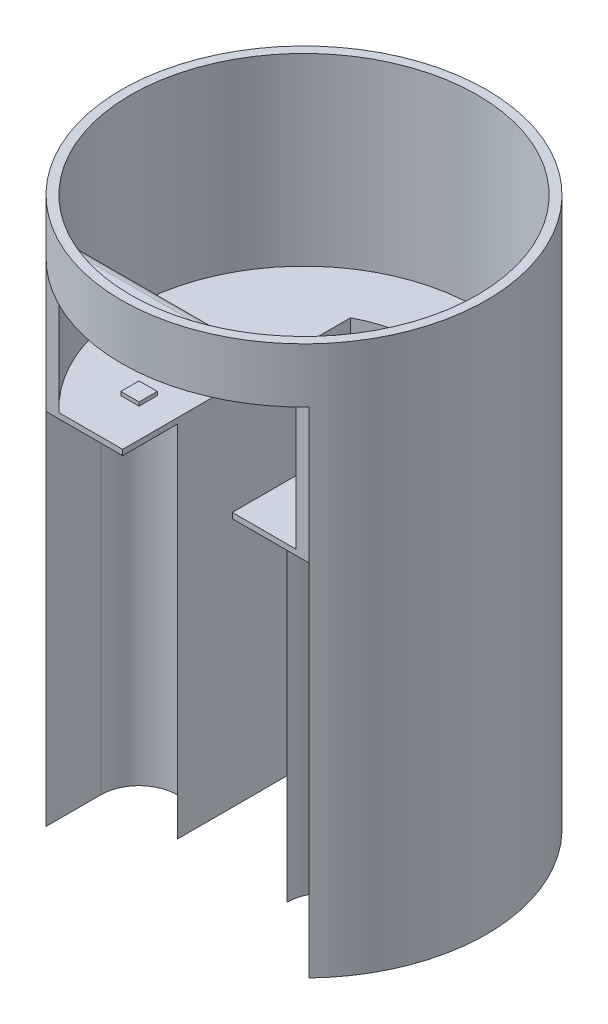
from build123d import *
from build123d.topology import SkipClean

# Parameters (mm, degrees)
BOSS_EXTRUDE2_DEPTH   = 200
BOSS_EXTRUDE2_2_DEPTH = 200
BOSS_EXTRUDE3_START   = -3
SKETCH3_W             = 10
SKETCH3_H             = 10
BOSS_EXTRUDE3_DEPTH   = 3
SKETCH4_W             = 10
SKETCH4_H             = 10
BOSS_EXTRUDE4_DEPTH   = 3
SKETCH5_W             = 10
SKETCH5_H             = 10
BOSS_EXTRUDE5_DEPTH   = 2
BOSS_EXTRUDE5_2_DEPTH = 2
BOSS_EXTRUDE6_START   = -200
BOSS_EXTRUDE6_DEPTH   = 200
BOSS_EXTRUDE7_DEPTH   = 101
BOSS_EXTRUDE8_START   = -15
BOSS_EXTRUDE8_DEPTH   = 15
BOSS_EXTRUDE9_START   = 15
BOSS_EXTRUDE9_DEPTH   = 15
FILLET2_R             = 6


with BuildPart() as part:
    # Sketch2 → Boss-Extrude2 (new body)
    with BuildSketch(Plane(origin=(0, 0, 0), x_dir=(1, 0, 0), z_dir=(0, 1, 0))):
        with BuildLine():
            Line((-29.936750537, 95.41378814), (-29.936750537, -39.462967992))
            ThreePointArc((-29.936750537, -39.462967992), (-50.936750537, -18.462967992), (-71.936750537, -39.462967992))
            Line((-71.936750537, -39.462967992), (-71.936750537, -69.462967992))
            ThreePointArc((-71.936750537, -69.462967992), (-96.905308077, 24.685243904), (-29.936750537, 95.41378814))
        make_face()
    extrude(amount=BOSS_EXTRUDE2_DEPTH)

    # Sketch3 → Boss-Extrude3 (add)
    with BuildSketch(Plane(origin=(0, 200, 0), x_dir=(1, 0, 0), z_dir=(0, 1, 0)).offset(BOSS_EXTRUDE3_START)):
        with BuildLine():
            Line((-71.936750537, -69.462967992), (-29.936750537, -69.462967992))
            Line((-29.936750537, -69.462967992), (-29.936750537, -39.462967992))
            ThreePointArc((-29.936750537, -39.462967992), (-50.936750537, -18.462967992), (-71.936750537, -39.462967992))
            Line((-71.936750537, -39.462967992), (-71.936750537, -69.462967992))
        make_face()
        with Locations((-50.936750537, -39.462967992)):
            Rectangle(SKETCH3_W, SKETCH3_H, mode=Mode.SUBTRACT)
    extrude(amount=BOSS_EXTRUDE3_DEPTH)



with BuildPart() as body_2:
    # Sketch2 → Boss-Extrude2 2 (new body)
    with BuildSketch(Plane(origin=(0, 0, 0), x_dir=(1, 0, 0), z_dir=(0, 1, 0))):
        with BuildLine():
            ThreePointArc((72.063249463, -69.331724894), (96.899173876, 24.709312052), (30.063249463, 95.374006059))
            Line((30.063249463, 95.374006059), (30.063249463, -39.462967992))
            ThreePointArc((30.063249463, -39.462967992), (51.063249463, -18.462967992), (72.063249463, -39.462967992))
            Line((72.063249463, -39.462967992), (72.063249463, -69.331724894))
        make_face()
    extrude(amount=BOSS_EXTRUDE2_2_DEPTH)

    # Sketch4 → Boss-Extrude4 (add)
    with BuildSketch(Plane(origin=(0, 200, 0), x_dir=(1, 0, 0), z_dir=(0, 1, 0))):
        with BuildLine():
            Line((30.063249463, -39.462967992), (30.063249463, -69.331724894))
            Line((30.063249463, -69.331724894), (72.063249463, -69.331724894))
            Line((72.063249463, -69.331724894), (72.063249463, -39.462967992))
            ThreePointArc((72.063249463, -39.462967992), (51.063249463, -18.462967992), (30.063249463, -39.462967992))
        make_face()
        with Locations((51.063249463, -39.462967992)):
            Rectangle(SKETCH4_W, SKETCH4_H, mode=Mode.SUBTRACT)
    extrude(amount=-BOSS_EXTRUDE4_DEPTH)


with BuildPart() as body_3:
    # Sketch5 → Boss-Extrude5 (new body)
    with BuildSketch(Plane(origin=(0, 200, 0), x_dir=(1, 0, 0), z_dir=(0, 1, 0))):
        with Locations((51.063249463, -39.462967992)):
            Rectangle(SKETCH5_W, SKETCH5_H)
    extrude(amount=BOSS_EXTRUDE5_DEPTH)


with BuildPart() as body_4:
    # Sketch5 → Boss-Extrude5 2 (new body)
    with BuildSketch(Plane(origin=(0, 200, 0), x_dir=(1, 0, 0), z_dir=(0, 1, 0))):
        with Locations((-50.936750537, -39.462967992)):
            Rectangle(SKETCH5_W, SKETCH5_H)
    extrude(amount=BOSS_EXTRUDE5_2_DEPTH)


with BuildPart() as part_1:
    add(part.part)

    add(body_2.part)  # Boss-Extrude6 merges body 2
    # Sketch7 → Boss-Extrude6 (add)
    with BuildSketch(Plane(origin=(0, 200, 0), x_dir=(1, 0, 0), z_dir=(0, 1, 0)).offset(BOSS_EXTRUDE6_START)):
        with BuildLine():
            Line((-29.936750537, 95.41378814), (-29.936750537, 55.432760777))
            ThreePointArc((-29.936750537, 55.432760777), (0.071928174, 62.999958939), (30.063249463, 55.364257709))
            Line((30.063249463, 55.364257709), (30.063249463, 95.374006059))
            ThreePointArc((30.063249463, 95.374006059), (0.066303455, 99.999978019), (-29.936750537, 95.41378814))
        make_face()
    extrude(amount=BOSS_EXTRUDE6_DEPTH)

    # Sketch8 → Boss-Extrude7 (add)
    with SkipClean():  # the faces are left unmerged after this step: merging them gives an invalid solid
        with BuildSketch(Plane(origin=(0, 200, 0), x_dir=(1, 0, 0), z_dir=(0, 1, 0))):
            with BuildLine():
                Line((-71.936750537, -69.462967992), (-64.806605202, -69.462967992))
                ThreePointArc((-64.806605202, -69.462967992), (-0.096090498, 94.999951403), (64.946993181, -69.331724894))
                Line((64.946993181, -69.331724894), (72.063249463, -69.331724894))
                ThreePointArc((72.063249463, -69.331724894), (-0.091141002, 99.999958467), (-71.936750537, -69.462967992))
            make_face()
        extrude(amount=BOSS_EXTRUDE7_DEPTH)
    add(part_1.part.scale(1), mode=Mode.REPLACE)  # the faces are merged on a copy

    # Sketch10 → Boss-Extrude8 (add)
    with BuildSketch(Plane(origin=(0, 301, 0), x_dir=(1, 0, 0), z_dir=(0, 1, 0)).offset(BOSS_EXTRUDE8_START)):
        with BuildLine():
            Line((-71.936750537, -69.462967992), (-64.806605202, -69.462967992))
            ThreePointArc((-64.806605202, -69.462967992), (0.096090498, -94.999951403), (64.946993181, -69.331724894))
            Line((64.946993181, -69.331724894), (72.063249463, -69.331724894))
            ThreePointArc((72.063249463, -69.331724894), (0.091141002, -99.999958467), (-71.936750537, -69.462967992))
        make_face()
    extrude(amount=BOSS_EXTRUDE8_DEPTH)

    # Sketch11 → Boss-Extrude9 (add)
    with SkipClean():  # the faces are left unmerged after this step: merging them gives an invalid solid
        with BuildSketch(Plane.XZ.offset(-286).offset(BOSS_EXTRUDE9_START)):
            with BuildLine():
                ThreePointArc((72.063249463, 69.331724894), (0.091141002, 99.999958467), (-71.936750537, 69.462967992))
                Line((-71.936750537, 69.462967992), (-64.806605202, 69.462967992))
                ThreePointArc((-64.806605202, 69.462967992), (0.096090498, 94.999951403), (64.946993181, 69.331724894))
                Line((64.946993181, 69.331724894), (72.063249463, 69.331724894))
            make_face()
            with BuildLine():
                Line((-64.806605202, 69.462967992), (64.946993181, 69.331724894))
                ThreePointArc((64.946993181, 69.331724894), (0.096090498, 94.999951403), (-64.806605202, 69.462967992))
            make_face()
        extrude(amount=-BOSS_EXTRUDE9_DEPTH)
    add(part_1.part.scale(1), mode=Mode.REPLACE)  # the faces are merged on a copy

    # Fillet2
    # the kernel refuses this fillet: 6 mm, written as the material it takes off along each edge
    with BuildSketch(Plane(origin=(-79.806597528, 286, 69.478140176), x_dir=(0, -1, 0), z_dir=(0.9999994884550568, 0, -0.0010114789294520309))) as fillet2_piece_1_section:
        with BuildLine():
            CenterArc((FILLET2_R, -FILLET2_R), FILLET2_R, 90, 90)
            Line((0, -FILLET2_R), (0, 0))
            Line((0, 0), (FILLET2_R, 0))
        make_face()
    fillet2_piece_1 = extrude(amount=159.753664757, mode=Mode.PRIVATE)
    fillet2_piece_1 = fillet2_piece_1 & Plane(origin=(0, 284.623966258, 0), x_dir=(-0.6821747915961063, 0, 0.7311891367565639), z_dir=(0, -1, 0)) * Cylinder(95, 344, mode=Mode.PRIVATE)
    add(fillet2_piece_1, mode=Mode.SUBTRACT)


solid = Compound([body_3.part, body_4.part, part_1.part])
